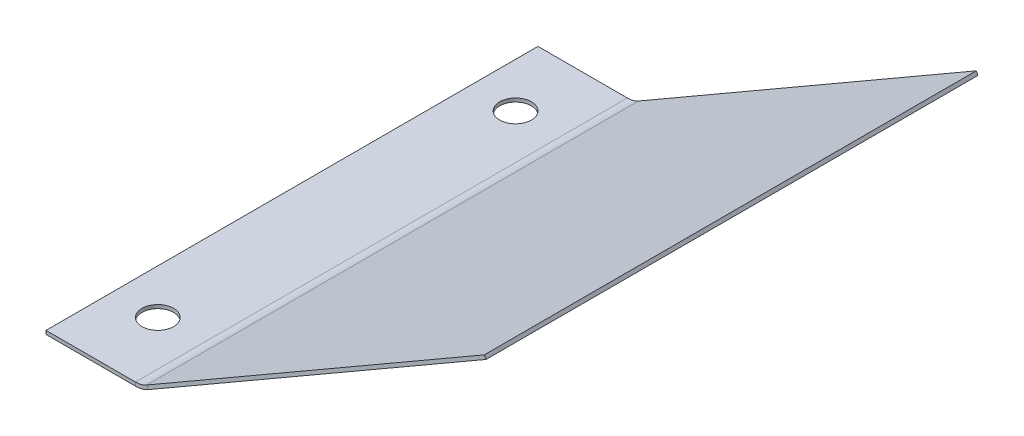
from build123d import *

# Parameters (mm, degrees)
SKETCH2_W             = 12.7
SKETCH2_H             = 69.85
BOSS_EXTRUDE2_DEPTH   = 0.508
EDGE_FLANGE2_DEPTH    = 69.85
F_8_CLEARANCE_HOLE1_D = 4.4958


# Sheet-metal steps are written as plain solids
with BuildPart() as part:
    # Sketch2 → Boss-Extrude2 (new body)
    with BuildSketch(Plane(origin=(0, 0, 0), x_dir=(1, 0, 0), z_dir=(0, 1, 0))):
        with Locations((-6.35, 34.925)):
            Rectangle(SKETCH2_W, SKETCH2_H)
    extrude(amount=BOSS_EXTRUDE2_DEPTH)

    # Edge-Flange2 section (across the edge) → Edge-Flange2 (add)
    with BuildSketch(Plane(origin=(0.850738686, 0.508, 0), x_dir=(-0.49999999999999495, 0.8660254037844416, 0), z_dir=(0, 0, -1))):
        with BuildLine():
            Line((-0.508, 0.850738686), (-0.508, 56.2102))
            Line((-0.508, 56.2102), (0, 56.2102))
            Line((0, 56.2102), (0, 0.850738686))
            ThreePointArc((0, 0.850738686), (0.108185502, 0.028988218), (0.425369343, -0.736761314))
            Line((0.425369343, -0.736761314), (-0.014571562, -0.990761314))
            ThreePointArc((-0.014571562, -0.990761314), (-0.382504818, -0.102491857), (-0.508, 0.850738686))
        make_face()
    extrude(amount=EDGE_FLANGE2_DEPTH)

    # #8 Clearance Hole1 (through all)
    with Locations(Plane(origin=(0, 0, 0), x_dir=(-1, 0, 0), z_dir=(0, -1, 0))):
        with Locations((6.35, 60.325), (6.35, 9.525)):
            Hole(F_8_CLEARANCE_HOLE1_D / 2)


solid = part.part
